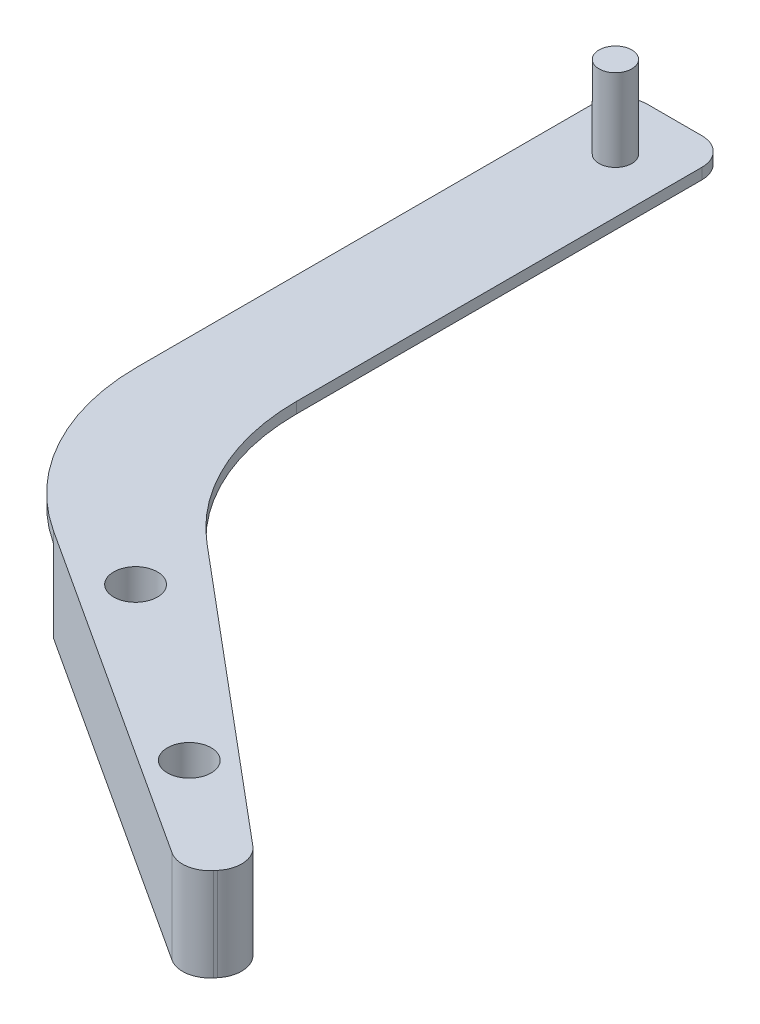
from build123d import *

# Parameters (mm, degrees)
SKETCH1_R           = 4
BASE_FLANGE1_DEPTH  = 2
SKETCH6_R           = 4
BOSS_EXTRUDE1_DEPTH = 15
SKETCH7_R           = 3
BOSS_EXTRUDE2_DEPTH = 15
FILLET2_R           = 5


# Sheet-metal steps are written as plain solids
with BuildPart() as part:
    # Sketch1 → Base-Flange1 (new body)
    with BuildSketch(Plane(origin=(0, 0, 0), x_dir=(1, 0, 0), z_dir=(0, 1, 0))):
        with BuildLine():
            Line((8.214438599, -24.009587925), (73.867056795, -66.644896694))
            Line((73.867056795, -66.644896694), (80.294932891, -58.984452263))
            Line((80.294932891, -58.984452263), (24.288495613, -11.989471399))
            ThreePointArc((24.288495613, -11.989471399), (13.747688519, 1.747575857), (10, 18.652306326))
            Line((10, 18.652306326), (10, 97.819006808))
            Line((10, 97.819006808), (-10, 97.819006808))
            Line((-10, 97.819006808), (-10, 9.537234793))
            ThreePointArc((-10, 9.537234793), (-5.152684506, -9.549115617), (8.214438599, -24.009587925))
        make_face()
        with Locations(Location((24.288495613, -25.043544292, 0), (0, 0, 270))):
            Circle(SKETCH1_R, mode=Mode.SUBTRACT)
        with Locations(Location((57.054577384, -47.986601746, 0), (0, 0, 270))):
            Circle(SKETCH1_R, mode=Mode.SUBTRACT)
    extrude(amount=-BASE_FLANGE1_DEPTH)

    # Sketch6 → Boss-Extrude1 (add)
    with BuildSketch(Plane.XZ.offset(2)):
        Polygon((8.214438599, 24.009587925), (73.867056795, 66.644896694), (80.294932891, 58.984452263), (24.288495613, 11.989471399), align=None)
        with Locations(Location((24.288495613, 25.043544292, 0), (0, 0, 90))):
            Circle(SKETCH6_R, mode=Mode.SUBTRACT)
        with Locations(Location((57.054577384, 47.986601746, 0), (0, 0, 90))):
            Circle(SKETCH6_R, mode=Mode.SUBTRACT)
    extrude(amount=BOSS_EXTRUDE1_DEPTH)

    # Sketch7 → Boss-Extrude2 (add)
    with BuildSketch(Plane(origin=(0, 0, 0), x_dir=(1, 0, 0), z_dir=(0, 1, 0))):
        with Locations(Location((0, 87, 0), (0, 0, 90))):
            Circle(SKETCH7_R)
    extrude(amount=BOSS_EXTRUDE2_DEPTH)

    # Fillet2
    fillet2_edges = [part.edges().sort_by_distance(p)[0] for p in [
        (73.867056795, -8.5, 66.644896694),
        (-10, -1, -97.819006808),
        (10, -1, -97.819006808),
        (80.294932891, -8.5, 58.984452263),
    ]]
    fillet(fillet2_edges, radius=FILLET2_R)


solid = part.part
